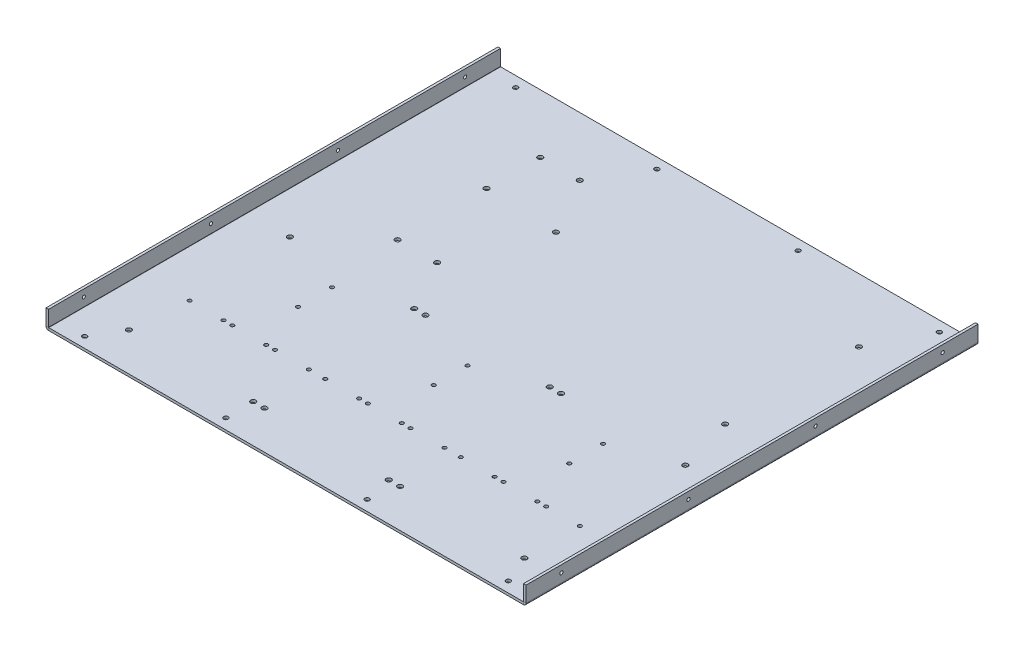
from build123d import *

# Parameters (mm, degrees)
BASE_FLANGE3_DEPTH  = 406.4
SKETCH10_R          = 1.4478
CUT_EXTRUDE3_DEPTH  = 594.198769469
SKETCH11_R          = 2.032
CUT_EXTRUDE4_DEPTH  = 594.139546967
CUT_EXTRUDE10_START = 2.286
SKETCH13_R          = 1.651
SKETCH13_R_2        = 2.286
CUT_EXTRUDE10_DEPTH = 2.286
SKETCH14_R          = 2.286
CUT_EXTRUDE11_DEPTH = 2.286


# Sheet-metal steps are written as plain solids
with BuildPart() as part:
    # Sketch1 → Base-Flange3 (new body)
    with BuildSketch(Plane.XY):
        with BuildLine():
            Line((431.8, 16.51), (431.8, 2.4384))
            ThreePointArc((431.8, 2.4384), (431.085809175, 0.714190825), (429.3616, 0))
            Line((429.3616, 0), (2.4384, 0))
            ThreePointArc((2.4384, 0), (0.714190825, 0.714190825), (0, 2.4384))
            Line((0, 2.4384), (0, 16.51))
            Line((0, 16.51), (2.286, 16.51))
            Line((2.286, 16.51), (2.286, 2.4384))
            ThreePointArc((2.286, 2.4384), (2.330636927, 2.330636927), (2.4384, 2.286))
            Line((2.4384, 2.286), (429.3616, 2.286))
            ThreePointArc((429.3616, 2.286), (429.469363073, 2.330636927), (429.514, 2.4384))
            Line((429.514, 2.4384), (429.514, 16.51))
            Line((429.514, 16.51), (431.8, 16.51))
        make_face()
    extrude(amount=BASE_FLANGE3_DEPTH)

    # Sketch10 → Cut-Extrude3 (cut, through all)
    with BuildSketch(Plane(origin=(431.8, 0, 0), x_dir=(0, 0, -1), z_dir=(1, 0, 0))):
        with Locations((-31.75, 10.16)):
            Circle(SKETCH10_R)
        with Locations((-146.05, 10.16)):
            Circle(SKETCH10_R)
        with Locations((-260.35, 10.16)):
            Circle(SKETCH10_R)
        with Locations((-374.65, 10.16)):
            Circle(SKETCH10_R)
    extrude(amount=-CUT_EXTRUDE3_DEPTH, mode=Mode.SUBTRACT)

    # Sketch11 → Cut-Extrude4 (cut, through all)
    with BuildSketch(Plane(origin=(0, 2.286, 0), x_dir=(-1, 0, 0), z_dir=(0, 1, 0))):
        with Locations(Location((-406.4, 397.002, 0), (0, 0, 90))):
            Circle(SKETCH11_R)
        with Locations(Location((-279.4, 397.002, 0), (0, 0, 90))):
            Circle(SKETCH11_R)
        with Locations(Location((-152.4, 397.002, 0), (0, 0, 90))):
            Circle(SKETCH11_R)
        with Locations(Location((-25.4, 397.002, 0), (0, 0, 90))):
            Circle(SKETCH11_R)
        with Locations(Location((-406.4, 9.398, 0), (0, 0, 90))):
            Circle(SKETCH11_R)
        with Locations(Location((-279.4, 9.398, 0), (0, 0, 90))):
            Circle(SKETCH11_R)
        with Locations(Location((-152.4, 9.398, 0), (0, 0, 90))):
            Circle(SKETCH11_R)
        with Locations(Location((-25.4, 9.398, 0), (0, 0, 90))):
            Circle(SKETCH11_R)
    extrude(amount=-CUT_EXTRUDE4_DEPTH, mode=Mode.SUBTRACT)

    # Sketch13 → Cut-Extrude10 (cut)
    with BuildSketch(Plane(origin=(13.91994535, 0, 411.979952645), x_dir=(0, 0, -1), z_dir=(0, 1, 0)).offset(CUT_EXTRUDE10_START)):
        with Locations(Location((89.98703359, -313.064950531, 0), (0, 0, 180))):
            Circle(SKETCH13_R)
        with Locations(Location((89.98703359, -343.544950531, 0), (0, 0, 180))):
            Circle(SKETCH13_R)
        with Locations(Location((89.98703359, -274.710950531, 0), (0, 0, 180))):
            Circle(SKETCH13_R)
        with Locations(Location((89.98703359, -305.190950531, 0), (0, 0, 180))):
            Circle(SKETCH13_R)
        with Locations(Location((89.98703359, -351.418950531, 0), (0, 0, 180))):
            Circle(SKETCH13_R)
        with Locations(Location((89.98703359, -381.898950531, 0), (0, 0, 180))):
            Circle(SKETCH13_R)
        with Locations(Location((133.92903359, -328.304950531, 0), (0, 0, 180))):
            Circle(SKETCH13_R)
        with Locations(Location((164.40903359, -328.304950531, 0), (0, 0, 180))):
            Circle(SKETCH13_R)
        with Locations(Location((39.94903359, -381.898950531, 0), (0, 0, 180))):
            Circle(SKETCH13_R_2)
        with Locations(Location((184.72903359, -381.898950531, 0), (0, 0, 180))):
            Circle(SKETCH13_R_2)
        with Locations(Location((39.94903359, -270.138950531, 0), (0, 0, 180))):
            Circle(SKETCH13_R_2)
        with Locations(Location((184.72903359, -270.138950531, 0), (0, 0, 180))):
            Circle(SKETCH13_R_2)
        with Locations(Location((89.98703359, -191.144950531, 0), (0, 0, 180))):
            Circle(SKETCH13_R)
        with Locations(Location((89.98703359, -221.624950531, 0), (0, 0, 180))):
            Circle(SKETCH13_R)
        with Locations(Location((89.98703359, -152.790950531, 0), (0, 0, 180))):
            Circle(SKETCH13_R)
        with Locations(Location((89.98703359, -183.270950531, 0), (0, 0, 180))):
            Circle(SKETCH13_R)
        with Locations(Location((89.98703359, -229.498950531, 0), (0, 0, 180))):
            Circle(SKETCH13_R)
        with Locations(Location((89.98703359, -259.978950531, 0), (0, 0, 180))):
            Circle(SKETCH13_R)
        with Locations(Location((133.92903359, -206.384950531, 0), (0, 0, 180))):
            Circle(SKETCH13_R)
        with Locations(Location((164.40903359, -206.384950531, 0), (0, 0, 180))):
            Circle(SKETCH13_R)
        with Locations(Location((39.94903359, -259.978950531, 0), (0, 0, 180))):
            Circle(SKETCH13_R_2)
        with Locations(Location((184.72903359, -259.978950531, 0), (0, 0, 180))):
            Circle(SKETCH13_R_2)
        with Locations(Location((39.94903359, -148.218950531, 0), (0, 0, 180))):
            Circle(SKETCH13_R_2)
        with Locations(Location((184.72903359, -148.218950531, 0), (0, 0, 180))):
            Circle(SKETCH13_R_2)
        with Locations(Location((89.98703359, -69.224950531, 0), (0, 0, 180))):
            Circle(SKETCH13_R)
        with Locations(Location((89.98703359, -99.704950531, 0), (0, 0, 180))):
            Circle(SKETCH13_R)
        with Locations(Location((89.98703359, -30.870950531, 0), (0, 0, 180))):
            Circle(SKETCH13_R)
        with Locations(Location((89.98703359, -61.350950531, 0), (0, 0, 180))):
            Circle(SKETCH13_R)
        with Locations(Location((89.98703359, -107.578950531, 0), (0, 0, 180))):
            Circle(SKETCH13_R)
        with Locations(Location((89.98703359, -138.058950531, 0), (0, 0, 180))):
            Circle(SKETCH13_R)
        with Locations(Location((133.92903359, -84.464950531, 0), (0, 0, 180))):
            Circle(SKETCH13_R)
        with Locations(Location((164.40903359, -84.464950531, 0), (0, 0, 180))):
            Circle(SKETCH13_R)
        with Locations(Location((39.94903359, -138.058950531, 0), (0, 0, 180))):
            Circle(SKETCH13_R_2)
        with Locations(Location((184.72903359, -138.058950531, 0), (0, 0, 180))):
            Circle(SKETCH13_R_2)
        with Locations(Location((39.94903359, -26.298950531, 0), (0, 0, 180))):
            Circle(SKETCH13_R_2)
        with Locations(Location((184.72903359, -26.298950531, 0), (0, 0, 180))):
            Circle(SKETCH13_R_2)
    extrude(amount=-CUT_EXTRUDE10_DEPTH, mode=Mode.SUBTRACT)

    # Sketch14 → Cut-Extrude11 (cut)
    with BuildSketch(Plane(origin=(0, 2.286, 0), x_dir=(1, 0, 0), z_dir=(0, 1, 0))):
        with Locations(Location((156.154345185, -103.963043442, 0), (0, 0, 270))):
            Circle(SKETCH14_R)
        with Locations(Location((381.687370192, -56.973043442, 0), (0, 0, 270))):
            Circle(SKETCH14_R)
        with Locations(Location((381.687370192, -177.369043442, 0), (0, 0, 270))):
            Circle(SKETCH14_R)
        with Locations(Location((126.436345185, -181.077443442, 0), (0, 0, 270))):
            Circle(SKETCH14_R)
        with Locations(Location((90.876345185, -181.077443442, 0), (0, 0, 270))):
            Circle(SKETCH14_R)
        with Locations(Location((90.876345185, -101.067443442, 0), (0, 0, 270))):
            Circle(SKETCH14_R)
        with Locations(Location((90.876345185, -52.807443442, 0), (0, 0, 270))):
            Circle(SKETCH14_R)
        with Locations(Location((126.436345185, -52.807443442, 0), (0, 0, 270))):
            Circle(SKETCH14_R)
    extrude(amount=-CUT_EXTRUDE11_DEPTH, mode=Mode.SUBTRACT)


solid = part.part
